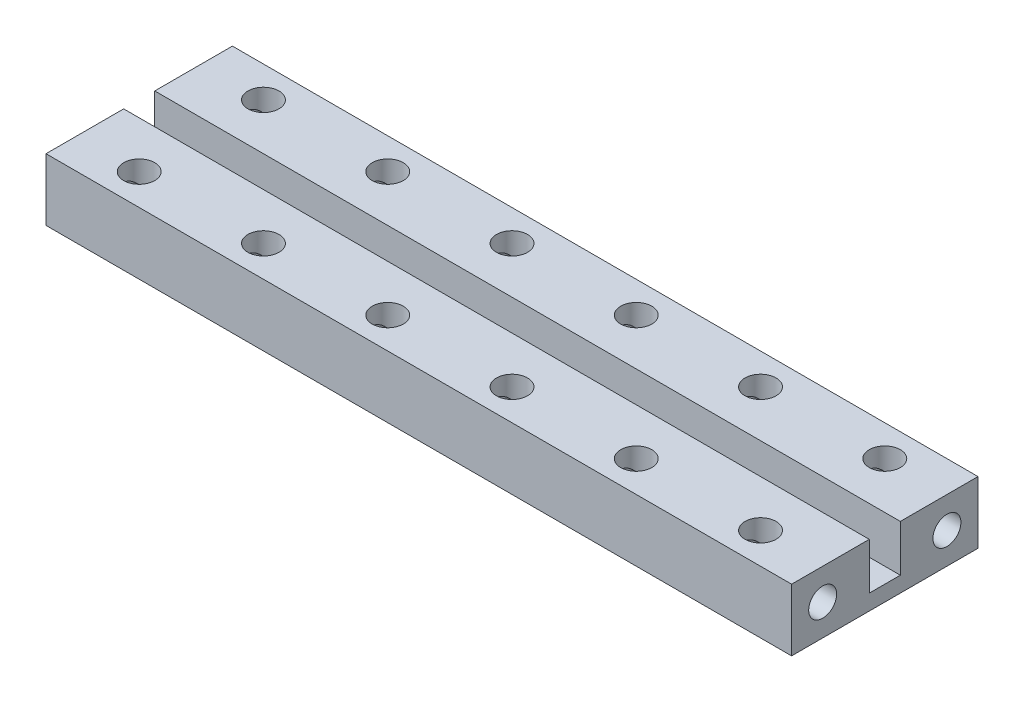
from build123d import *

# Parameters (mm, degrees)
SKETCH_1_W          = 96
SKETCH_1_H          = 24
EXTRUDE_1_DEPTH     = 8
SKETCH_2_W          = 96
SKETCH_2_H          = 4
CUT_EXTRUDE_1_DEPTH = 6
SKETCH_3_R          = 1.8
CUT_EXTRUDE_2_DEPTH = 98.077288796
SKETCH_4_R          = 2
CUT_EXTRUDE_3_DEPTH = 51.119856345


with BuildPart() as part:
    # 스케치1 → 보스-돌출1 (new body)
    with BuildSketch(Plane(origin=(0, 0, 0), x_dir=(1, 0, 0), z_dir=(0, 1, 0))):
        Rectangle(SKETCH_1_W, SKETCH_1_H)
    extrude(amount=EXTRUDE_1_DEPTH)

    # 스케치2 → 컷-돌출1 (cut)
    with BuildSketch(Plane(origin=(0, 8, 0), x_dir=(1, 0, 0), z_dir=(0, 1, 0))):
        Rectangle(SKETCH_2_W, SKETCH_2_H)
    extrude(amount=-CUT_EXTRUDE_1_DEPTH, mode=Mode.SUBTRACT)

    # 스케치3 → 컷-돌출2 (cut, through all)
    with BuildSketch(Plane.ZY.offset(48)):
        with Locations((-8, 4)):
            Circle(SKETCH_3_R)
        with Locations((8, 4)):
            Circle(SKETCH_3_R)
    extrude(amount=-CUT_EXTRUDE_2_DEPTH, mode=Mode.SUBTRACT)

    # 스케치4 → 컷-돌출3 (cut, through all)
    with BuildSketch(Plane(origin=(0, 8, 0), x_dir=(1, 0, 0), z_dir=(0, 1, 0))):
        with Locations((-40, 8)):
            Circle(SKETCH_4_R)
        with Locations((-24, 8)):
            Circle(SKETCH_4_R)
        with Locations((-40, -8)):
            Circle(SKETCH_4_R)
        with Locations((-24, -8)):
            Circle(SKETCH_4_R)
        with Locations((-8, 8)):
            Circle(SKETCH_4_R)
        with Locations((-8, -8)):
            Circle(SKETCH_4_R)
        with Locations((8, 8)):
            Circle(SKETCH_4_R)
        with Locations((8, -8)):
            Circle(SKETCH_4_R)
        with Locations((24, 8)):
            Circle(SKETCH_4_R)
        with Locations((24, -8)):
            Circle(SKETCH_4_R)
        with Locations((40, -8)):
            Circle(SKETCH_4_R)
        with Locations((40, 8)):
            Circle(SKETCH_4_R)
    extrude(amount=-CUT_EXTRUDE_3_DEPTH, mode=Mode.SUBTRACT)


solid = part.part
